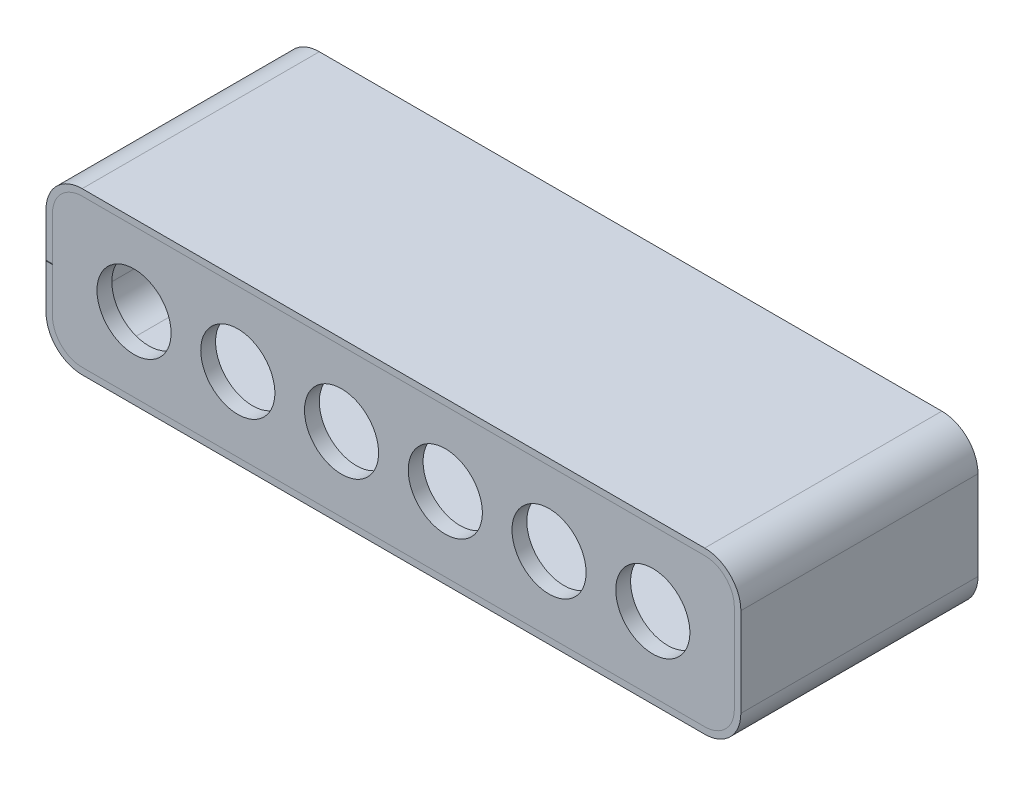
from build123d import *

# Parameters (mm, degrees)
SKETCH1_W           = 292.1
SKETCH1_H           = 63.5
BOSS_EXTRUDE1_DEPTH = 6.35
FILLET1_R           = 12.7
BOSS_EXTRUDE2_DEPTH = 101.6
BOSS_EXTRUDE3_DEPTH = 6.35
SKETCH2_R           = 15.875
CUT_EXTRUDE1_DEPTH  = 184.494916202


with BuildPart() as part:
    # Sketch1 → Boss-Extrude1 (new body)
    with BuildSketch(Plane.XY):
        Rectangle(SKETCH1_W, SKETCH1_H)
    extrude(amount=BOSS_EXTRUDE1_DEPTH)

    # Fillet1
    fillet1_edges = [part.edges().sort_by_distance(p)[0] for p in [
        (-146.05, -31.75, 3.175),
        (146.05, -31.75, 3.175),
        (146.05, 31.75, 3.175),
        (-146.05, 31.75, 3.175),
    ]]
    fillet(fillet1_edges, radius=FILLET1_R)


with BuildPart() as body_2:
    # Sketch3 → Boss-Extrude2 (new body)
    with BuildSketch(Plane.XY):
        with BuildLine():
            Line((133.35, 34.544), (-133.35, 34.544))
            ThreePointArc((-133.35, 34.544), (-144.305912468, 30.005912468), (-148.844, 19.05))
            Line((-148.844, 19.05), (-148.844, 0.254))
            Line((-148.844, 0.254), (-146.05, 0.254))
            Line((-146.05, 0.254), (-146.05, 19.05))
            ThreePointArc((-146.05, 19.05), (-142.330256121, 28.030256121), (-133.35, 31.75))
            Line((-133.35, 31.75), (133.35, 31.75))
            ThreePointArc((133.35, 31.75), (142.330256121, 28.030256121), (146.05, 19.05))
            Line((146.05, 19.05), (146.05, -19.05))
            ThreePointArc((146.05, -19.05), (142.330256121, -28.030256121), (133.35, -31.75))
            Line((133.35, -31.75), (-133.35, -31.75))
            ThreePointArc((-133.35, -31.75), (-142.330256121, -28.030256121), (-146.05, -19.05))
            Line((-146.05, -19.05), (-146.05, 0))
            Line((-146.05, 0), (-148.844, 0))
            Line((-148.844, 0), (-148.844, -19.05))
            ThreePointArc((-148.844, -19.05), (-144.305912468, -30.005912468), (-133.35, -34.544))
            Line((-133.35, -34.544), (133.35, -34.544))
            ThreePointArc((133.35, -34.544), (144.305912468, -30.005912468), (148.844, -19.05))
            Line((148.844, -19.05), (148.844, 19.05))
            ThreePointArc((148.844, 19.05), (144.305912468, 30.005912468), (133.35, 34.544))
        make_face()
    extrude(amount=BOSS_EXTRUDE2_DEPTH)


with BuildPart() as body_3:
    # Sketch4 → Boss-Extrude3 (new body)
    with BuildSketch(Plane.XY.offset(101.6)):
        with BuildLine():
            Line((-146.05, 19.05), (-146.05, -19.05))
            ThreePointArc((-146.05, -19.05), (-142.330256121, -28.030256121), (-133.35, -31.75))
            Line((-133.35, -31.75), (133.35, -31.75))
            ThreePointArc((133.35, -31.75), (142.330256121, -28.030256121), (146.05, -19.05))
            Line((146.05, -19.05), (146.05, 19.05))
            ThreePointArc((146.05, 19.05), (142.330256121, 28.030256121), (133.35, 31.75))
            Line((133.35, 31.75), (-133.35, 31.75))
            ThreePointArc((-133.35, 31.75), (-142.330256121, 28.030256121), (-146.05, 19.05))
        make_face()
    extrude(amount=-BOSS_EXTRUDE3_DEPTH)

    # Sketch2 → Cut-Extrude1 (cut, through all)
    with BuildSketch(Plane(origin=(0, 0, 0), x_dir=(-1, 0, 0), z_dir=(0, 0, -1))):
        with Locations((-111.125, 0)):
            Circle(SKETCH2_R)
        with Locations((-66.675, 0)):
            Circle(SKETCH2_R)
        with Locations((-22.225, 0)):
            Circle(SKETCH2_R)
        with Locations((22.225, 0)):
            Circle(SKETCH2_R)
        with Locations((66.675, 0)):
            Circle(SKETCH2_R)
        with Locations((111.125, 0)):
            Circle(SKETCH2_R)
    extrude(amount=-CUT_EXTRUDE1_DEPTH, mode=Mode.SUBTRACT)


solid = Compound([part.part, body_2.part, body_3.part])
